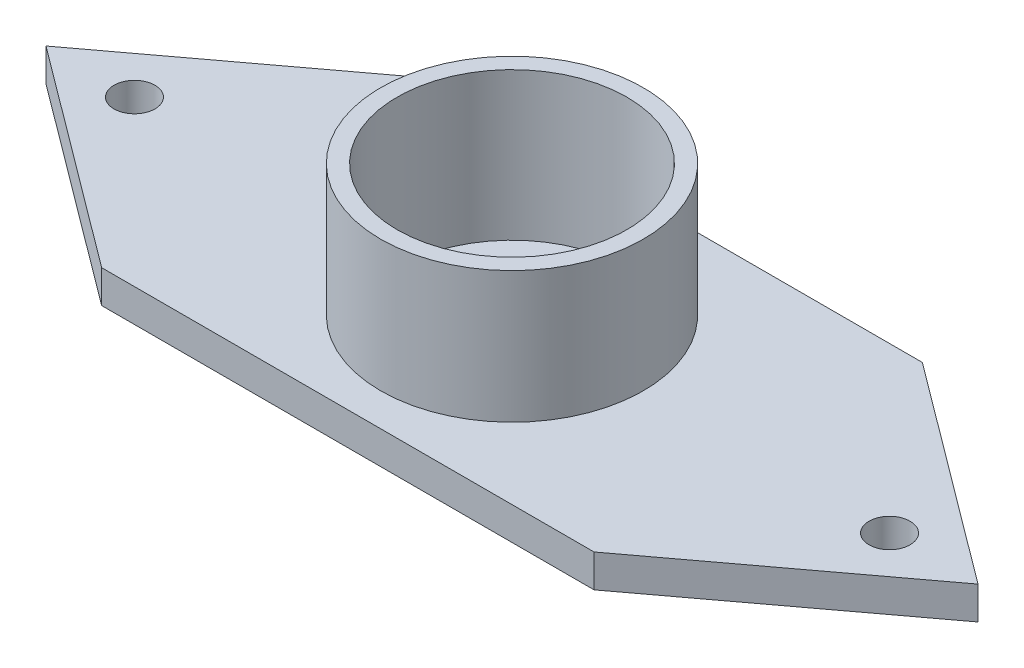
from build123d import *

# Parameters (mm, degrees)
SKETCH1_W           = 30
SKETCH1_H           = 20
BOSS_EXTRUDE1_DEPTH = 2
SKETCH4_R           = 8
BOSS_EXTRUDE2_DEPTH = 8
SHELL1_START        = 1
SHELL1_OUTLINE_R    = 7
SHELL1_DEPTH        = 9
SKETCH5_R           = 1.25
CUT_EXTRUDE1_DEPTH  = 8
SKETCH6_R           = 1.25
CUT_EXTRUDE2_DEPTH  = 8


# Read off the part's stored shape, not the designer's step: Shell1
with BuildPart() as part:
    # Sketch1 → Boss-Extrude1 (new body)
    with BuildSketch(Plane(origin=(0, 0, 0), x_dir=(1, 0, 0), z_dir=(0, 1, 0))):
        Polygon((30, 0), (43.389820148, 10), (30, 20), align=None)
        Polygon((0, 20), (-13.389820148, 10), (0, 0), align=None)
        with Locations((15, 10)):
            Rectangle(SKETCH1_W, SKETCH1_H)
    extrude(amount=BOSS_EXTRUDE1_DEPTH)

    # Sketch4 → Boss-Extrude2 (add)
    with BuildSketch(Plane(origin=(0, 2, 0), x_dir=(1, 0, 0), z_dir=(0, 1, 0))):
        with Locations(Location((15, 10, 0), (0, 0, 270))):
            Circle(SKETCH4_R)
    extrude(amount=BOSS_EXTRUDE2_DEPTH)

    # Shell1 outline → Shell1 (cut)
    with BuildSketch(Plane(origin=(0, 0, 0), x_dir=(1, 0, 0), z_dir=(0, 1, 0)).offset(SHELL1_START)):
        with Locations((15, 10)):
            Circle(SHELL1_OUTLINE_R)
    extrude(amount=SHELL1_DEPTH, mode=Mode.SUBTRACT)

    # Sketch5 → Cut-Extrude1 (cut)
    with BuildSketch(Plane(origin=(0, 2, 0), x_dir=(1, 0, 0), z_dir=(0, 1, 0))):
        with Locations(Location((-8, 10, 0), (0, 0, 270))):
            Circle(SKETCH5_R)
    extrude(amount=-CUT_EXTRUDE1_DEPTH, mode=Mode.SUBTRACT)

    # Sketch6 → Cut-Extrude2 (cut)
    with BuildSketch(Plane(origin=(0, 2, 0), x_dir=(1, 0, 0), z_dir=(0, 1, 0))):
        with Locations(Location((38, 10, 0), (0, 0, 270))):
            Circle(SKETCH6_R)
    extrude(amount=-CUT_EXTRUDE2_DEPTH, mode=Mode.SUBTRACT)


solid = part.part
